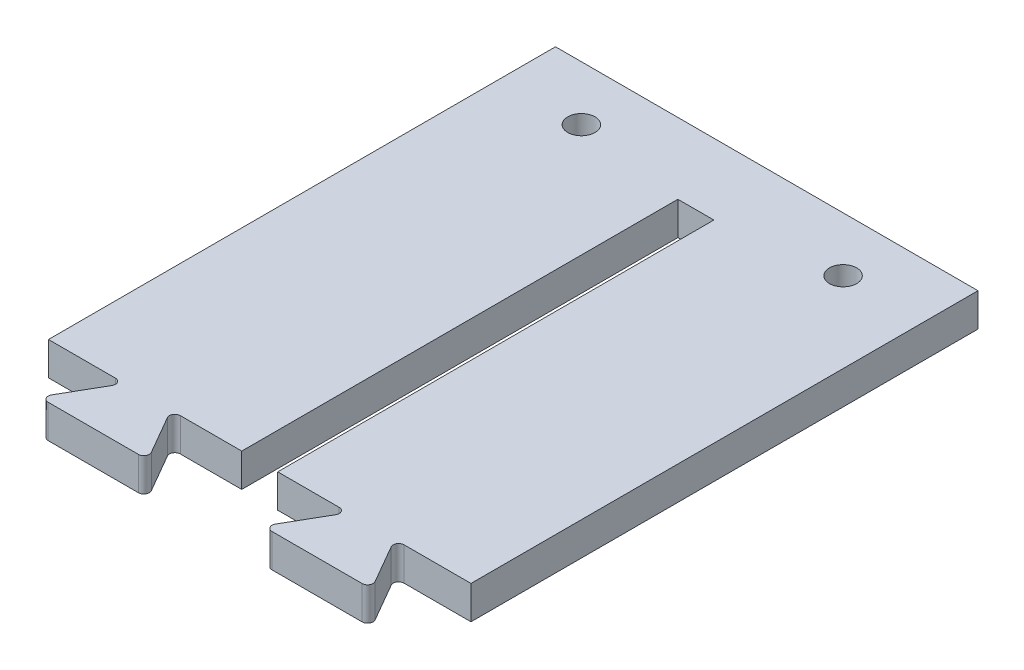
from build123d import *

# Parameters (mm, degrees)
BOSS_EXTRUDE1_DEPTH      = 3.05
FILLET1_R                = 0.5
SKETCH3_W                = 3.3
SKETCH3_H                = 40
SKETCH3_H_2              = 1
CUT_EXTRUDE2_DEPTH       = 51.467248043
M3_TAPPED_DAMPER_HOLES_D = 2.5


with BuildPart() as part:
    # Sketch1 → Boss-Extrude1 (new body)
    with BuildSketch(Plane(origin=(0, 0, 0), x_dir=(1, 0, 0), z_dir=(0, 1, 0))):
        Polygon((-19.375, 0), (-19.375, 46.5), (19.375, 46.5), (19.375, 0), (12.375, 0), (15.261751346, -5), (5.261751346, -5), (8.148502692, 0), (-8.148502692, 0), (-5.261751346, -5), (-15.261751346, -5), (-12.375, 0), align=None)
    extrude(amount=BOSS_EXTRUDE1_DEPTH)

    # Fillet1
    fillet1_edges = [part.edges().sort_by_distance(p)[0] for p in [
        (12.375, 1.525, 0),
        (15.261751346, 1.525, 5),
        (5.261751346, 1.525, 5),
        (8.148502692, 1.525, 0),
        (-8.148502692, 1.525, 0),
        (-5.261751346, 1.525, 5),
        (-15.261751346, 1.525, 5),
        (-12.375, 1.525, 0),
    ]]
    fillet(fillet1_edges, radius=FILLET1_R)

    # Sketch3 → Cut-Extrude2 (cut, through all)
    with BuildSketch(Plane(origin=(0, 3.05, 0), x_dir=(1, 0, 0), z_dir=(0, 1, 0))):
        with Locations((0, 20)):
            Rectangle(SKETCH3_W, SKETCH3_H)
        with Locations((0, -1.7)):
            Rectangle(SKETCH3_W, SKETCH3_H_2)
    extrude(amount=-CUT_EXTRUDE2_DEPTH, mode=Mode.SUBTRACT)

    # M3 Tapped Damper Holes (through all)
    with Locations(Plane(origin=(0, 3.05, 0), x_dir=(1, 0, 0), z_dir=(0, 1, 0))):
        with Locations((-12, 41.5), (12, 41.5)):
            Hole(M3_TAPPED_DAMPER_HOLES_D / 2)


solid = part.part
